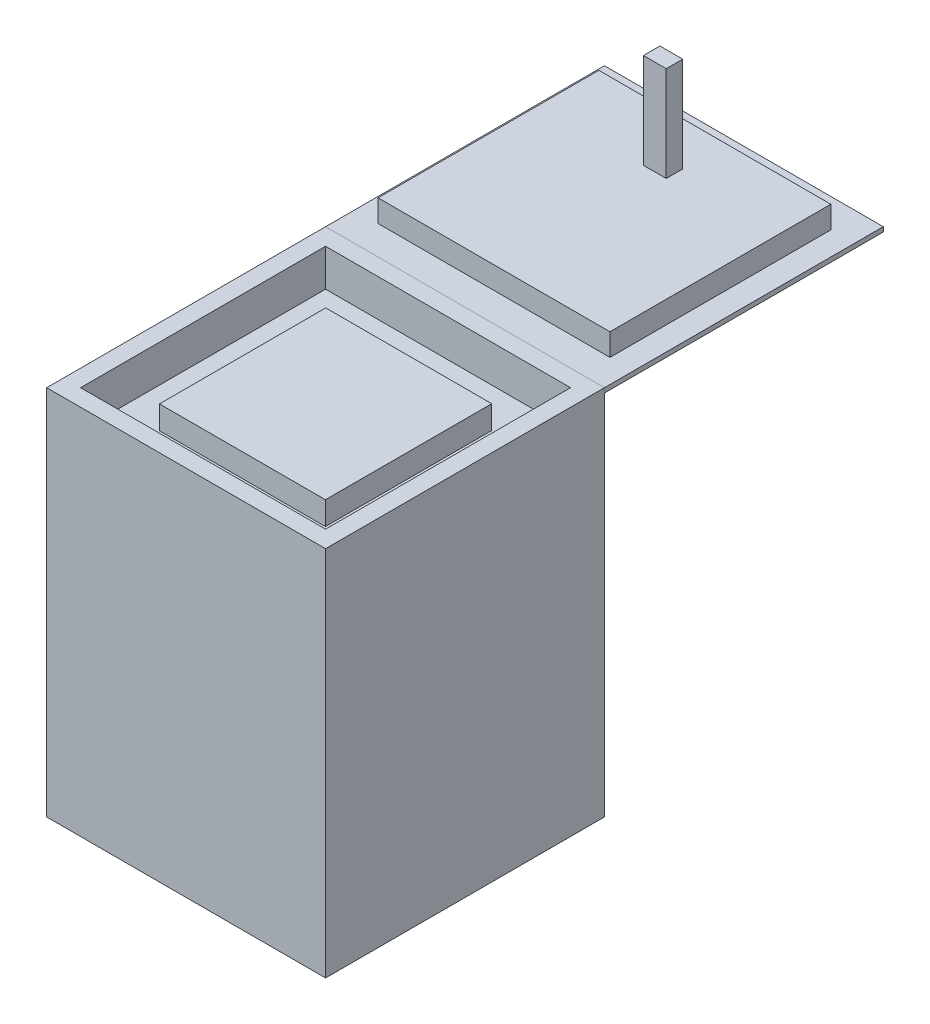
from build123d import *

# Parameters (mm, degrees)
SKETCH1_W           = 600
SKETCH1_H           = 600
BOSS_EXTRUDE1_DEPTH = 800
SKETCH2_W           = 527.145840922
SKETCH2_H           = 527.145840922
CUT_EXTRUDE2_DEPTH  = 80
SKETCH3_W           = 357.119076562
SKETCH3_H           = 357.823453438
BOSS_EXTRUDE2_DEPTH = 50
SKETCH4_W           = 600
SKETCH4_H           = 600
BOSS_EXTRUDE3_DEPTH = 10
SKETCH7_W           = 475.188659882
SKETCH7_H           = 47.834663464
BOSS_EXTRUDE8_DEPTH = 249.5
SKETCH15_W          = 35.508173295
SKETCH15_H          = 204.665336536
BOSS_EXTRUDE9_DEPTH = 24.5


with BuildPart() as part:
    # Sketch1 → Boss-Extrude1 (new body)
    with BuildSketch(Plane(origin=(0, 0, 0), x_dir=(1, 0, 0), z_dir=(0, 1, 0))):
        Rectangle(SKETCH1_W, SKETCH1_H)
    extrude(amount=BOSS_EXTRUDE1_DEPTH)

    # Sketch2 → Cut-Extrude2 (cut)
    with BuildSketch(Plane(origin=(0, 800, 0), x_dir=(1, 0, 0), z_dir=(0, 1, 0))):
        Rectangle(SKETCH2_W, SKETCH2_H)
    extrude(amount=-CUT_EXTRUDE2_DEPTH, mode=Mode.SUBTRACT)

    # Sketch3 → Boss-Extrude2 (add)
    with BuildSketch(Plane(origin=(0, 720, 0), x_dir=(1, 0, 0), z_dir=(0, 1, 0))):
        Rectangle(SKETCH3_W, SKETCH3_H)
    extrude(amount=BOSS_EXTRUDE2_DEPTH)


with BuildPart() as body_2:
    # Sketch4 → Boss-Extrude3 (new body)
    with BuildSketch(Plane(origin=(0, 800, 0), x_dir=(1, 0, 0), z_dir=(0, 1, 0))):
        with Locations((0, 600)):
            Rectangle(SKETCH4_W, SKETCH4_H)
    extrude(amount=-BOSS_EXTRUDE3_DEPTH)


with BuildPart() as body_3:
    # Sketch7 → Boss-Extrude8 (new, symmetric)
    with BuildSketch(Plane(origin=(0, 0, 0), x_dir=(0, 0, -1), z_dir=(1, 0, 0))):
        with Locations((600, 823.917331732)):
            Rectangle(SKETCH7_W, SKETCH7_H)
    extrude(amount=BOSS_EXTRUDE8_DEPTH, both=True)

    # Sketch15 → Boss-Extrude9 (add, symmetric)
    with BuildSketch(Plane(origin=(0, 0, 0), x_dir=(0, 0, -1), z_dir=(1, 0, 0))):
        with Locations((726.23170897, 950.167331732)):
            Rectangle(SKETCH15_W, SKETCH15_H)
    extrude(amount=BOSS_EXTRUDE9_DEPTH, both=True)


solid = Compound([part.part, body_2.part, body_3.part])
